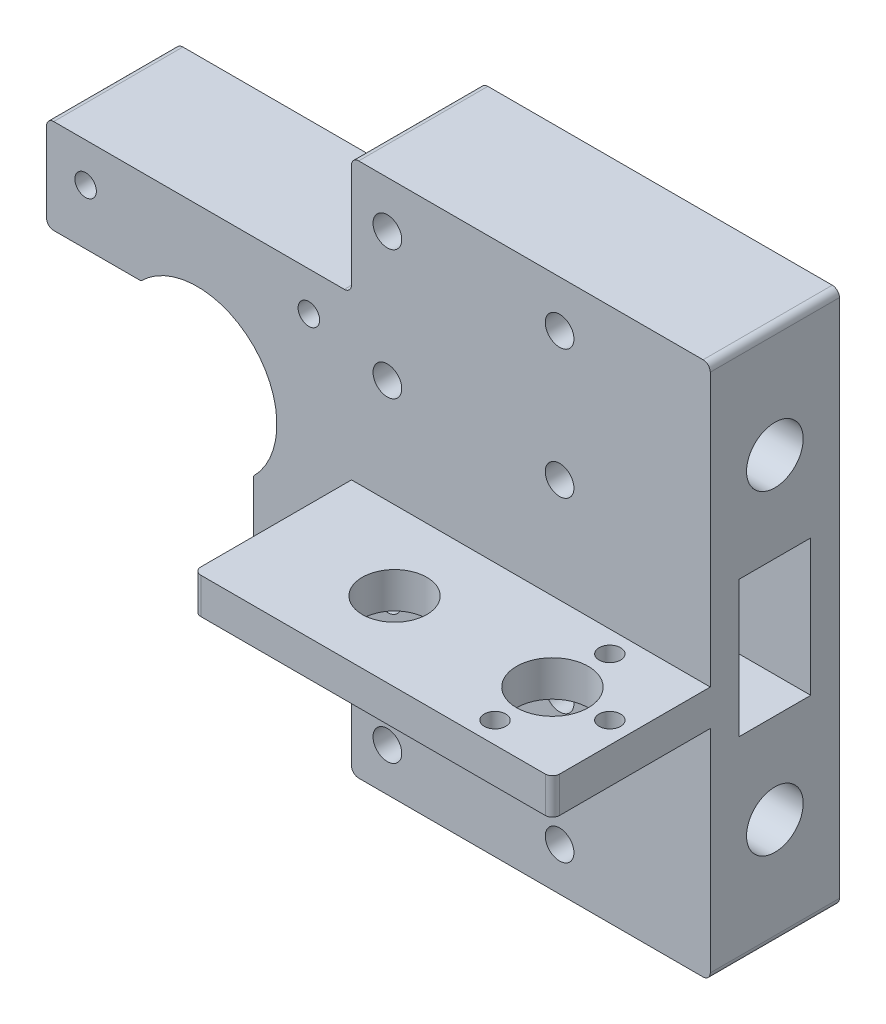
from build123d import *

# Parameters (mm, degrees)
SKETCH1_W           = 50
SKETCH1_H           = 74
SKETCH1_R           = 2
BOSS_EXTRUDE1_DEPTH = 18
SKETCH5_W           = 50
SKETCH5_H           = 18
BOSS_EXTRUDE3_DEPTH = 5.5
SKETCH7_W           = 50
SKETCH7_H           = 5
BOSS_EXTRUDE5_DEPTH = 22
FILLET2_R           = 1
SKETCH13_R          = 3.95
SKETCH13_W          = 10
SKETCH13_H          = 19
CUT_EXTRUDE4_DEPTH  = 20
SKETCH15_R          = 4.5
SKETCH15_R_2        = 5
CUT_EXTRUDE6_DEPTH  = 15
CUT_EXTRUDE7_REACH  = 67.622
SKETCH16_W          = 10
SKETCH16_H          = 19
SKETCH18_R          = 3.95
CUT_EXTRUDE8_DEPTH  = 8
SKETCH19_R          = 1.5
BOSS_EXTRUDE6_DEPTH = 18
BOSS_EXTRUDE7_START = -44
SKETCH23_R          = 5
SKETCH23_R_2        = 4.5
BOSS_EXTRUDE7_DEPTH = 5
CUT_EXTRUDE9_REACH  = 91.233
CUT_EXTRUDE10_REACH = 76.204
SKETCH25_W          = 10
SKETCH25_H          = 19
FILLET3_DEPTH       = 18
FILLET3_START       = -1
FILLET3_2_DEPTH     = 20
FILLET3_START_2     = -7
FILLET3_3_DEPTH     = 6
CUT_EXTRUDE11_REACH = 89.62
SKETCH26_R          = 1.5


with BuildPart() as part:
    # Sketch1 → Boss-Extrude1 (new body)
    with BuildSketch(Plane.XY):
        Rectangle(SKETCH1_W, SKETCH1_H)
        with Locations((-20, 31)):
            Circle(SKETCH1_R, mode=Mode.SUBTRACT)
        with Locations((4, 31)):
            Circle(SKETCH1_R, mode=Mode.SUBTRACT)
        with Locations((4, 13)):
            Circle(SKETCH1_R, mode=Mode.SUBTRACT)
        with Locations((-20, 13)):
            Circle(SKETCH1_R, mode=Mode.SUBTRACT)
        with Locations((-20, -13)):
            Circle(SKETCH1_R, mode=Mode.SUBTRACT)
        with Locations((4, -13)):
            Circle(SKETCH1_R, mode=Mode.SUBTRACT)
        with Locations((4, -31)):
            Circle(SKETCH1_R, mode=Mode.SUBTRACT)
        with Locations((-20, -31)):
            Circle(SKETCH1_R, mode=Mode.SUBTRACT)
    extrude(amount=BOSS_EXTRUDE1_DEPTH)

    # Sketch5 → Boss-Extrude3 (add)
    with BuildSketch(Plane(origin=(0, 37, 0), x_dir=(1, 0, 0), z_dir=(0, 1, 0))):
        with Locations((0, -9)):
            Rectangle(SKETCH5_W, SKETCH5_H)
    extrude(amount=BOSS_EXTRUDE3_DEPTH)

    # Sketch7 → Boss-Extrude5 (add)
    with BuildSketch(Plane.XY.offset(18)):
        with Locations((0, 40)):
            Rectangle(SKETCH7_W, SKETCH7_H)
    extrude(amount=BOSS_EXTRUDE5_DEPTH)

    # Fillet2
    fillet2_edges = [part.edges().sort_by_distance(p)[0] for p in [
        (25, 42.5, 20),
        (-25, 42.5, 20),
        (25, -37, 9),
        (-25, -37, 9),
    ]]
    fillet(fillet2_edges, radius=FILLET2_R)

    # Sketch13 → Cut-Extrude4 (cut)
    with BuildSketch(Plane(origin=(25, 0, 0), x_dir=(0, 0, -1), z_dir=(1, 0, 0))):
        with Locations((-9, 22)):
            Circle(SKETCH13_R)
        with Locations((-9, -22)):
            Circle(SKETCH13_R)
        with Locations((-9, 0)):
            Rectangle(SKETCH13_W, SKETCH13_H)
    extrude(amount=-CUT_EXTRUDE4_DEPTH, mode=Mode.SUBTRACT)

    # Sketch15 → Cut-Extrude6 (cut)
    with BuildSketch(Plane(origin=(0, 42.5, 0), x_dir=(1, 0, 0), z_dir=(0, 1, 0))):
        with Locations(Location((-8, -29, 0), (0, 0, 270))):
            Circle(SKETCH15_R)
        with Locations(Location((14, -29, 0), (0, 0, 270))):
            Circle(SKETCH15_R_2)
    extrude(amount=-CUT_EXTRUDE6_DEPTH, mode=Mode.SUBTRACT)

    # Sketch16 → Cut-Extrude7 (cut, up to next)
    with BuildSketch(Plane(origin=(5, 0, 0), x_dir=(0, 0, -1), z_dir=(1, 0, 0)), mode=Mode.PRIVATE) as cut_extrude7_sk1:
        with Locations((-9, 0)):
            Rectangle(SKETCH16_W, SKETCH16_H)
    cut_extrude7_tool1 = extrude(cut_extrude7_sk1.sketch, amount=-CUT_EXTRUDE7_REACH, mode=Mode.PRIVATE) & part.part
    add(cut_extrude7_tool1.solids().sort_by_distance((5, 0, 9))[0], mode=Mode.SUBTRACT)

    # Sketch18 → Cut-Extrude8 (cut)
    with BuildSketch(Plane(origin=(5, 0, 0), x_dir=(0, 0, -1), z_dir=(1, 0, 0))):
        with Locations((-9, -22)):
            Circle(SKETCH18_R)
        with Locations((-9, 22)):
            Circle(SKETCH18_R)
    extrude(amount=-CUT_EXTRUDE8_DEPTH, mode=Mode.SUBTRACT)

    # Sketch19 → Boss-Extrude6 (add)
    with BuildSketch(Plane.XY.offset(18)):
        with BuildLine():
            Line((-25, -24.565648185), (-25, 21))
            Line((-25, 21), (-67.5, 21))
            Line((-67.5, 21), (-67.5, 7.848885271))
            Line((-67.5, 7.848885271), (-54.348885271, 7.848885271))
            ThreePointArc((-54.348885271, 7.848885271), (-38.651114729, 7.848885271), (-38.651114729, -7.848885271))
            Line((-38.651114729, -7.848885271), (-38.651114729, -24.565648185))
            Line((-38.651114729, -24.565648185), (-25, -24.565648185))
        make_face()
        with Locations((-30.943650814, -15.556349186)):
            Circle(SKETCH19_R, mode=Mode.SUBTRACT)
        with Locations((-62.056349186, 15.556349186)):
            Circle(SKETCH19_R, mode=Mode.SUBTRACT)
        with Locations((-30.943650814, 15.556349186)):
            Circle(SKETCH19_R, mode=Mode.SUBTRACT)
    extrude(amount=-BOSS_EXTRUDE6_DEPTH)

    # Sketch23 → Boss-Extrude7 (add)
    with BuildSketch(Plane(origin=(0, 42.5, 0), x_dir=(1, 0, 0), z_dir=(0, 1, 0)).offset(BOSS_EXTRUDE7_START)):
        Polygon((-25, -40), (-24, -40), (24, -40), (25, -40), (25, -18), (-25, -18), align=None)
        with Locations(Location((14, -29, 0), (0, 0, 270))):
            Circle(SKETCH23_R, mode=Mode.SUBTRACT)
        with Locations(Location((-8, -29, 0), (0, 0, 270))):
            Circle(SKETCH23_R_2, mode=Mode.SUBTRACT)
    extrude(amount=-BOSS_EXTRUDE7_DEPTH)

    # Sketch24 → Cut-Extrude9 (cut, up to next)
    with BuildSketch(Plane.XY.offset(40), mode=Mode.PRIVATE) as cut_extrude9_sk1:
        with BuildLine():
            Line((25, 37.5), (25, 41.5))
            ThreePointArc((25, 41.5), (24.707106781, 42.207106781), (24, 42.5))
            Line((24, 42.5), (-24, 42.5))
            ThreePointArc((-24, 42.5), (-24.707106781, 42.207106781), (-25, 41.5))
            Line((-25, 41.5), (-25, 37.5))
            Line((-25, 37.5), (25, 37.5))
        make_face()
    cut_extrude9_tool1 = extrude(cut_extrude9_sk1.sketch, amount=-CUT_EXTRUDE9_REACH, mode=Mode.PRIVATE) & part.part
    add(cut_extrude9_tool1.solids().sort_by_distance((0, 39.996085, 40))[0], mode=Mode.SUBTRACT)

    # Sketch25 → Cut-Extrude10 (cut, up to next)
    with BuildSketch(Plane(origin=(-25, 0, 0), x_dir=(0, 0, -1), z_dir=(1, 0, 0)), mode=Mode.PRIVATE) as cut_extrude10_sk1:
        with Locations((-9, 0)):
            Rectangle(SKETCH25_W, SKETCH25_H)
    cut_extrude10_tool1 = extrude(cut_extrude10_sk1.sketch, amount=-CUT_EXTRUDE10_REACH, mode=Mode.PRIVATE) & part.part
    add(cut_extrude10_tool1.solids().sort_by_distance((-25, 0, 9))[0], mode=Mode.SUBTRACT)

    # Fillet3: read off the stored shape, not the designer's step
    # Fillet3 outline → Fillet3 (add)
    with BuildSketch(Plane.XY):
        with BuildLine():
            Line((-25, -24.565648185), (-26, -24.565648185))
            add(Edge.make_bspline(
                [(-26, -24.565648185), (-25, -24.565648185), (-25, -25.565648185)],
                knots=[0, 0, 0, 1, 1, 1], degree=2, weights=[1, 0.707106781, 1]))
            Line((-25, -25.565648185), (-25, -24.565648185))
        make_face()
        with BuildLine():
            Line((-25, 21), (-25, 22))
            add(Edge.make_bspline(
                [(-25, 22), (-25, 21), (-26, 21)],
                knots=[0, 0, 0, 1, 1, 1], degree=2, weights=[1, 0.707106781, 1]))
            Line((-26, 21), (-25, 21))
        make_face()
    extrude(amount=FILLET3_DEPTH)

    # Fillet3 2 outline → Fillet3 2 (cut)
    with BuildSketch(Plane.XY.offset(FILLET3_START)):
        with BuildLine():
            add(Edge.make_bspline(
                [(-38.651114729, -23.565648185), (-38.651114729, -24.565648185), (-37.651114729, -24.565648185)],
                knots=[0, 0, 0, 1, 1, 1], degree=2, weights=[1, 0.707106781, 1]))
            Line((-38.651114729, -23.565648185), (-38.651114729, -24.565648185))
            Line((-38.651114729, -24.565648185), (-37.651114729, -24.565648185))
        make_face()
        with BuildLine():
            Line((25, 37.5), (24, 37.5))
            add(Edge.make_bspline(
                [(25, 36.5), (25, 37.5), (24, 37.5)],
                knots=[0, 0, 0, 1, 1, 1], degree=2, weights=[1, 0.707106781, 1]))
            Line((25, 36.5), (25, 37.5))
        make_face()
        with BuildLine():
            Line((-25, 37.5), (-25, 36.5))
            add(Edge.make_bspline(
                [(-24, 37.5), (-25, 37.5), (-25, 36.5)],
                knots=[0, 0, 0, 1, 1, 1], degree=2, weights=[1, 0.707106781, 1]))
            Line((-24, 37.5), (-25, 37.5))
        make_face()
        with BuildLine():
            add(Edge.make_bspline(
                [(-67.5, 8.848885271), (-67.5, 7.848885271), (-66.5, 7.848885271)],
                knots=[0, 0, 0, 1, 1, 1], degree=2, weights=[1, 0.707106781, 1]))
            Line((-67.5, 8.848885271), (-67.5, 7.848885271))
            Line((-67.5, 7.848885271), (-66.5, 7.848885271))
        make_face()
        with BuildLine():
            add(Edge.make_bspline(
                [(-66.5, 21), (-67.5, 21), (-67.5, 20)],
                knots=[0, 0, 0, 1, 1, 1], degree=2, weights=[1, 0.707106781, 1]))
            Line((-66.5, 21), (-67.5, 21))
            Line((-67.5, 21), (-67.5, 20))
        make_face()
    extrude(amount=FILLET3_2_DEPTH, mode=Mode.SUBTRACT)

    # Fillet3 3 outline → Fillet3 3 (cut)
    with BuildSketch(Plane(origin=(0, 0, 0), x_dir=(1, 0, 0), z_dir=(0, 1, 0)).offset(FILLET3_START_2)):
        with BuildLine():
            Line((25, -40), (25, -39))
            add(Edge.make_bspline(
                [(25, -39), (25, -40), (24, -40)],
                knots=[0, 0, 0, 1, 1, 1], degree=2, weights=[1, 0.707106781, 1]))
            Line((24, -40), (25, -40))
        make_face()
        with BuildLine():
            Line((-25, -40), (-24, -40))
            add(Edge.make_bspline(
                [(-24, -40), (-25, -40), (-25, -39)],
                knots=[0, 0, 0, 1, 1, 1], degree=2, weights=[1, 0.707106781, 1]))
            Line((-25, -39), (-25, -40))
        make_face()
    extrude(amount=FILLET3_3_DEPTH, mode=Mode.SUBTRACT)

    # Sketch26 → Cut-Extrude11 (cut, up to next)
    with BuildSketch(Plane(origin=(0, -1.5, 0), x_dir=(1, 0, 0), z_dir=(0, 1, 0)), mode=Mode.PRIVATE) as cut_extrude11_sk1:
        with Locations(Location((14, -21, 0), (0, 0, 270))):
            Circle(SKETCH26_R)
    cut_extrude11_tool1 = extrude(cut_extrude11_sk1.sketch, amount=-CUT_EXTRUDE11_REACH, mode=Mode.PRIVATE) & part.part
    # Sketch26 → Cut-Extrude11 (cut, up to next)
    with BuildSketch(Plane(origin=(0, -1.5, 0), x_dir=(1, 0, 0), z_dir=(0, 1, 0)), mode=Mode.PRIVATE) as cut_extrude11_sk2:
        with Locations(Location((22, -29, 0), (0, 0, 270))):
            Circle(SKETCH26_R)
    cut_extrude11_tool2 = extrude(cut_extrude11_sk2.sketch, amount=-CUT_EXTRUDE11_REACH, mode=Mode.PRIVATE) & part.part
    # Sketch26 → Cut-Extrude11 (cut, up to next)
    with BuildSketch(Plane(origin=(0, -1.5, 0), x_dir=(1, 0, 0), z_dir=(0, 1, 0)), mode=Mode.PRIVATE) as cut_extrude11_sk3:
        with Locations(Location((14, -37, 0), (0, 0, 270))):
            Circle(SKETCH26_R)
    cut_extrude11_tool3 = extrude(cut_extrude11_sk3.sketch, amount=-CUT_EXTRUDE11_REACH, mode=Mode.PRIVATE) & part.part
    add(cut_extrude11_tool1.solids().sort_by_distance((14, -1.5, 21))[0], mode=Mode.SUBTRACT)
    add(cut_extrude11_tool2.solids().sort_by_distance((22, -1.5, 29))[0], mode=Mode.SUBTRACT)
    add(cut_extrude11_tool3.solids().sort_by_distance((14, -1.5, 37))[0], mode=Mode.SUBTRACT)


solid = part.part
